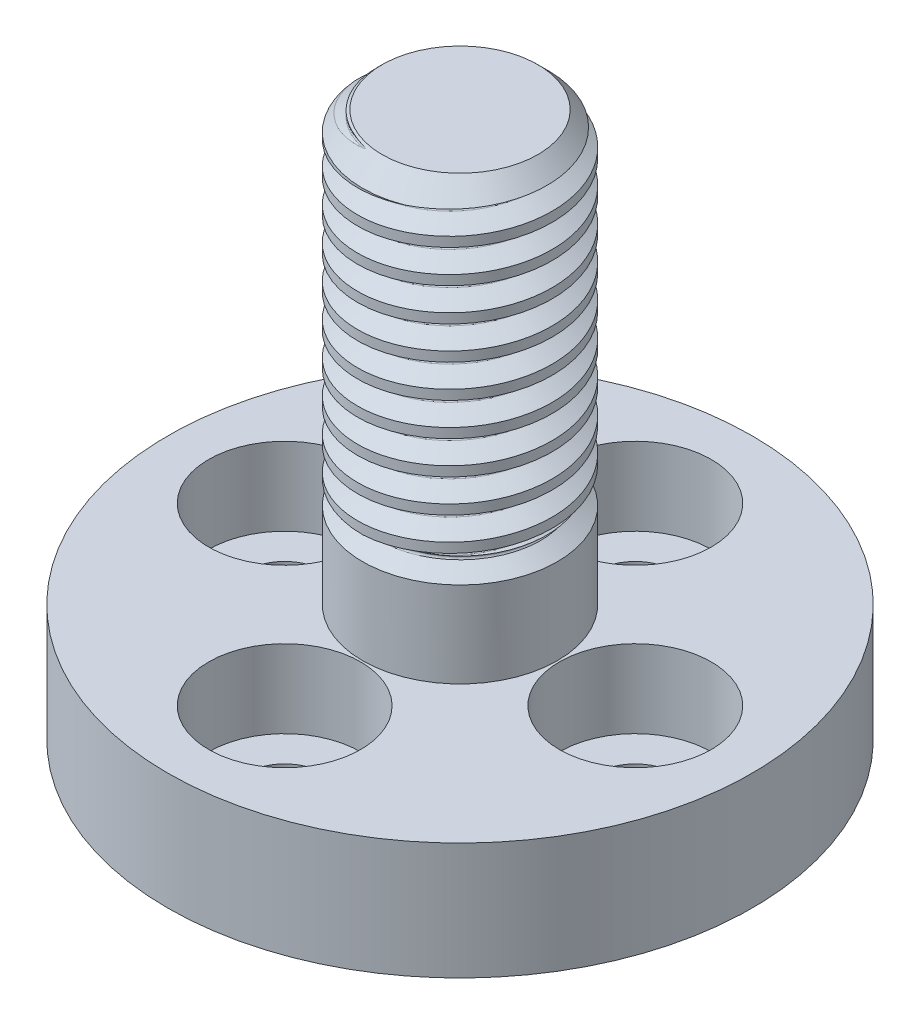
from build123d import *

# Parameters (mm, degrees)
SKETCH1_R           = 7.5
BOSS_EXTRUDE1_DEPTH = 3
SKETCH2_R           = 2.5
BOSS_EXTRUDE2_DEPTH = 11
CHAMFER1_SIZE       = 0.5
CUT_SWEEP1_PITCH    = 0.85
SKETCH7_R           = 1
CUT_EXTRUDE1_DEPTH  = 11
SKETCH8_R           = 1.95
CUT_EXTRUDE2_DEPTH  = 2
CIRPATTERN1_COUNT   = 4
SKETCH9_R           = 1
CUT_EXTRUDE3_DEPTH  = 5


with BuildPart() as part:
    # Sketch1 → Boss-Extrude1 (new body)
    with BuildSketch(Plane(origin=(0, 0, 0), x_dir=(1, 0, 0), z_dir=(0, 1, 0))):
        with Locations(Location((0, 0, 0), (0, 0, 270))):
            Circle(SKETCH1_R)
    extrude(amount=BOSS_EXTRUDE1_DEPTH)

    # Sketch2 → Boss-Extrude2 (add)
    with BuildSketch(Plane(origin=(0, 3, 0), x_dir=(1, 0, 0), z_dir=(0, 1, 0))):
        with Locations(Location((0, 0, 0), (0, 0, 270))):
            Circle(SKETCH2_R)
    extrude(amount=BOSS_EXTRUDE2_DEPTH)

    # Chamfer1
    chamfer1_edges = [part.edges().sort_by_distance(p)[0] for p in [
        (0, 14, -2.5),
    ]]
    chamfer(chamfer1_edges, length=CHAMFER1_SIZE)

    # Cut-Sweep1: the profile of Sketch4 profile screwed along a right-hand helix of 10.5 turns, 8 arcs to a turn; built about Z, then put on its axis
    cut_sweep1_z = Axis((0, 0, 0), (0, 0, 1))
    cut_sweep1_corners = [(2.5003, 0, -0.30018), (2.5003, 0, 0.30018), (2.071457744, 0, 0.042874646), (2.047182532, 0, 0), (2.071457744, 0, -0.042874646)]
    with BuildLine(mode=Mode.PRIVATE) as cut_sweep1_profile:
        Line(cut_sweep1_corners[0], cut_sweep1_corners[1])
        Line(cut_sweep1_corners[1], cut_sweep1_corners[2])
        Line(cut_sweep1_corners[4], cut_sweep1_corners[0])
        ThreePointArc((2.071457744, 0, 0.042874646), (2.053672536, 0, 0.024634941), (2.047182532, 0, 0))
        ThreePointArc((2.047182532, 0, 0), (2.053672536, 0, -0.024634941), (2.071457744, 0, -0.042874646))
    cut_sweep1_cap = Face(cut_sweep1_profile.wire())
    cut_sweep1_arcs = [((2.071457744, 0, 0.042874646), (2.047182532, 0, 0.028309519), (2.047182532, 0, 0), (1, 0.8701999067534769, 1)), ((2.047182532, 0, 0), (2.047182532, 0, -0.028309519), (2.071457744, 0, -0.042874646), (1, 0.8701999067534769, 1))]  # start, shoulder, end, weights
    cut_sweep1_turn_angles = [0, 22.5, 45, 67.5, 90, 112.5, 135, 157.5, 180, 202.5, 225, 247.5, 270, 292.5, 315, 337.5, 360]
    cut_sweep1_turn_weights = [1, 0.9238795325112867, 1, 0.9238795325112867, 1, 0.9238795325112867, 1, 0.9238795325112867, 1, 0.9238795325112867, 1, 0.9238795325112867, 1, 0.9238795325112867, 1, 0.9238795325112867, 1]
    cut_sweep1_turn_rails = [Edge.make_bspline([Vector(p[0], p[1], 0).rotate(cut_sweep1_z, cut_sweep1_turn_angles[k]) / cut_sweep1_turn_weights[k] + Vector(0, 0, p[2] + CUT_SWEEP1_PITCH * cut_sweep1_turn_angles[k] / 360) for k in range(17)], [0, 0, 0, 1, 1, 2, 2, 3, 3, 4, 4, 5, 5, 6, 6, 7, 7, 8, 8, 8], 2, cut_sweep1_turn_weights) for p in cut_sweep1_corners]
    cut_sweep1_turn_sides = [*[Face.make_surface_from_curves(cut_sweep1_turn_rails[p[0]], cut_sweep1_turn_rails[p[1]]) for p in [(0, 1), (1, 2), (4, 0)]], *[Face.make_bezier_surface([[Vector(p[j][0], p[j][1], 0).rotate(cut_sweep1_z, cut_sweep1_turn_angles[2 * i + k]) / cut_sweep1_turn_weights[2 * i + k] + Vector(0, 0, p[j][2] + CUT_SWEEP1_PITCH * cut_sweep1_turn_angles[2 * i + k] / 360) for k in range(3)] for j in range(3)], [[p[3][j] * cut_sweep1_turn_weights[2 * i + k] for k in range(3)] for j in range(3)]) for p in cut_sweep1_arcs for i in range(8)]]
    cut_sweep1_last_angles = [3600, 3622.5, 3645, 3667.5, 3690, 3712.5, 3735, 3757.5, 3780]
    cut_sweep1_last_weights = [1, 0.9238795325112867, 1, 0.9238795325112867, 1, 0.9238795325112867, 1, 0.9238795325112867, 1]
    cut_sweep1_last_rails = [Edge.make_bspline([Vector(p[0], p[1], 0).rotate(cut_sweep1_z, cut_sweep1_last_angles[k]) / cut_sweep1_last_weights[k] + Vector(0, 0, p[2] + CUT_SWEEP1_PITCH * cut_sweep1_last_angles[k] / 360) for k in range(9)], [0, 0, 0, 1, 1, 2, 2, 3, 3, 4, 4, 4], 2, cut_sweep1_last_weights) for p in cut_sweep1_corners]
    cut_sweep1_last_sides = [*[Face.make_surface_from_curves(cut_sweep1_last_rails[p[0]], cut_sweep1_last_rails[p[1]]) for p in [(0, 1), (1, 2), (4, 0)]], *[Face.make_bezier_surface([[Vector(p[j][0], p[j][1], 0).rotate(cut_sweep1_z, cut_sweep1_last_angles[2 * i + k]) / cut_sweep1_last_weights[2 * i + k] + Vector(0, 0, p[j][2] + CUT_SWEEP1_PITCH * cut_sweep1_last_angles[2 * i + k] / 360) for k in range(3)] for j in range(3)], [[p[3][j] * cut_sweep1_last_weights[2 * i + k] for k in range(3)] for j in range(3)]) for p in cut_sweep1_arcs for i in range(4)]]
    cut_sweep1 = Plane(origin=(0, 5.5, 0), x_dir=(0, 0, 1), z_dir=(0, 1, 0)) * Solid(Shell([*[p.moved(Location((0, 0, CUT_SWEEP1_PITCH * i))) for i in range(10) for p in cut_sweep1_turn_sides], *cut_sweep1_last_sides, cut_sweep1_cap, cut_sweep1_cap.rotate(cut_sweep1_z, 3780).moved(Location((0, 0, CUT_SWEEP1_PITCH * 3780 / 360)))]))
    add(cut_sweep1, mode=Mode.SUBTRACT)

    # Sketch5 → Cut-Revolve1 (revolve, cut)
    with BuildSketch(Plane(origin=(0, 0, 0), x_dir=(0, 0, -1), z_dir=(1, 0, 0)), mode=Mode.PRIVATE) as cut_revolve1_sk:
        with BuildLine():
            Line((-2.5, 5.8), (-2.5, 5.2))
            Line((-2.5, 5.2), (-2.071457744, 5.457125354))
            ThreePointArc((-2.071457744, 5.457125354), (-2.047182532, 5.5), (-2.071457744, 5.542874646))
            Line((-2.071457744, 5.542874646), (-2.5, 5.8))
        make_face()
    revolve(cut_revolve1_sk.sketch.rotate(Axis((0, 0, 0), (0, 1, 0)), 180), axis=Axis((0, 0, 0), (0, 1, 0)), mode=Mode.SUBTRACT)

    # Sketch7 → Cut-Extrude1 (cut)
    with BuildSketch(Plane.XZ):
        with Locations(Location((4.5, 0, 0), (0, 0, 270))):
            Circle(SKETCH7_R)
    cut_extrude1 = extrude(amount=-CUT_EXTRUDE1_DEPTH, mode=Mode.SUBTRACT)

    # Sketch8 → Cut-Extrude2 (cut)
    with BuildSketch(Plane(origin=(0, 3, 0), x_dir=(1, 0, 0), z_dir=(0, 1, 0))):
        with Locations(Location((4.5, 0, 0), (0, 0, 270))):
            Circle(SKETCH8_R)
    cut_extrude2 = extrude(amount=-CUT_EXTRUDE2_DEPTH, mode=Mode.SUBTRACT)

    # CirPattern1: Cut-Extrude1, Cut-Extrude2 ×4 about axis
    cirpattern1_axis = Axis((0, 0, 0), (0, 1, 0))
    add([cut_extrude1.rotate(cirpattern1_axis, i * 360 / CIRPATTERN1_COUNT) for i in range(1, CIRPATTERN1_COUNT)], mode=Mode.SUBTRACT)
    add([cut_extrude2.rotate(cirpattern1_axis, i * 360 / CIRPATTERN1_COUNT) for i in range(1, CIRPATTERN1_COUNT)], mode=Mode.SUBTRACT)

    # Sketch9 → Cut-Extrude3 (cut)
    with BuildSketch(Plane.XZ):
        with Locations(Location((0, 0, 0), (0, 0, 270))):
            Circle(SKETCH9_R)
    extrude(amount=-CUT_EXTRUDE3_DEPTH, mode=Mode.SUBTRACT)


solid = part.part
